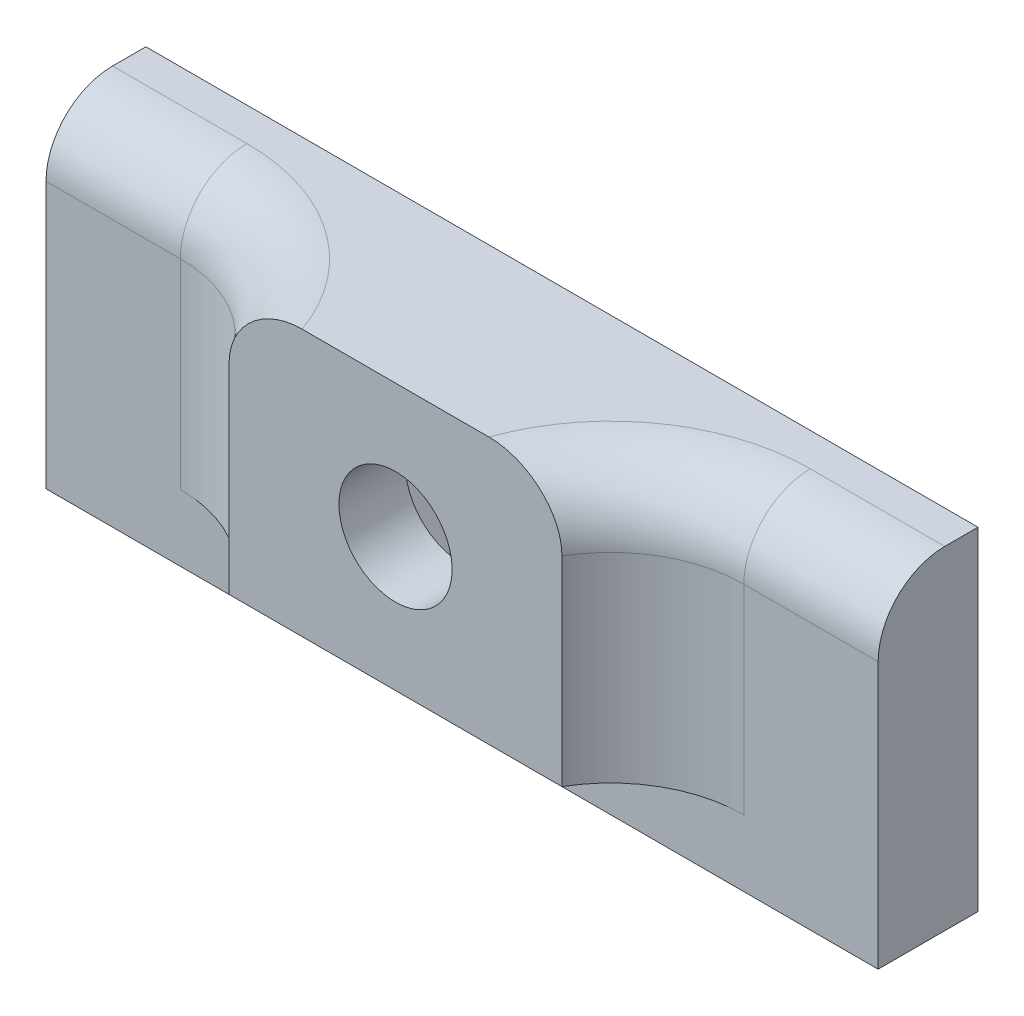
from build123d import *

# Parameters (mm, degrees)
SKETCH2_W           = 25
SKETCH2_H           = 10
BOSS_EXTRUDE1_DEPTH = 3
SKETCH5_W           = 10
SKETCH5_H           = 8
BOSS_EXTRUDE3_DEPTH = 2
FILLET2_R           = 4
SKETCH8_R           = 1.7
CUT_EXTRUDE3_DEPTH  = 17.770509831
CUT_EXTRUDE4_DEPTH  = 3
FILLET3_R           = 2


with BuildPart() as part:
    # Sketch2 → Boss-Extrude1 (new body)
    with BuildSketch(Plane.XY):
        with Locations((0, 5)):
            Rectangle(SKETCH2_W, SKETCH2_H)
    extrude(amount=BOSS_EXTRUDE1_DEPTH)

    # Sketch5 → Boss-Extrude3 (add)
    with BuildSketch(Plane.XY.offset(3)):
        with Locations((0, 6)):
            Rectangle(SKETCH5_W, SKETCH5_H)
    extrude(amount=BOSS_EXTRUDE3_DEPTH)

    # Fillet2
    # the kernel refuses this fillet: 4 mm, written as the material it adds along each edge
    with BuildSketch(Plane(origin=(5, 10, 3), x_dir=(1, 0, 0), z_dir=(0, -1, 0)), Plane(origin=(-5, 2, 3), x_dir=(-1, 0, 0), z_dir=(0, 1, 0))) as fillet2_piece_1:
        with BuildLine():
            CenterArc((3.464101615, 4), FILLET2_R, 210, 60)
            Line((0, 2), (-0.069282032, 1.96))
            ThreePointArc((-0.069282032, 1.96), (-0.08, 1), (-0.08, 0))
            Line((-0.08, 0), (0, -0.08))
            Line((0, -0.08), (3.464101615, -0.08))
            Line((3.464101615, -0.08), (3.464101615, 0))
        make_face()
    extrude(amount=8)

    # Sketch8 → Cut-Extrude3 (cut, through all)
    with BuildSketch(Plane(origin=(0, 0, 0), x_dir=(-1, 0, 0), z_dir=(0, 0, -1))):
        with Locations((0, 6)):
            Circle(SKETCH8_R)
    extrude(amount=-CUT_EXTRUDE3_DEPTH, mode=Mode.SUBTRACT)

    # Sketch9 → Cut-Extrude4 (cut)
    with BuildSketch(Plane(origin=(0, 0, 0), x_dir=(-1, 0, 0), z_dir=(0, 0, -1))):
        Polygon((3.464101615, 6), (1.732050808, 9), (-1.732050808, 9), (-3.464101615, 6), (-1.732050808, 3), (1.732050808, 3), align=None)
    extrude(amount=-CUT_EXTRUDE4_DEPTH, mode=Mode.SUBTRACT)

    # Fillet3
    fillet3_edges = [part.edges().sort_by_distance(p)[0] for p in [
        (-10.482050808, 10, 3),
        (6.464101615, 10, 3.535898385),
        (-6.464101615, 10, 3.535898385),
        (10.482050808, 10, 3),
    ]]
    fillet(fillet3_edges, radius=FILLET3_R)


solid = part.part
